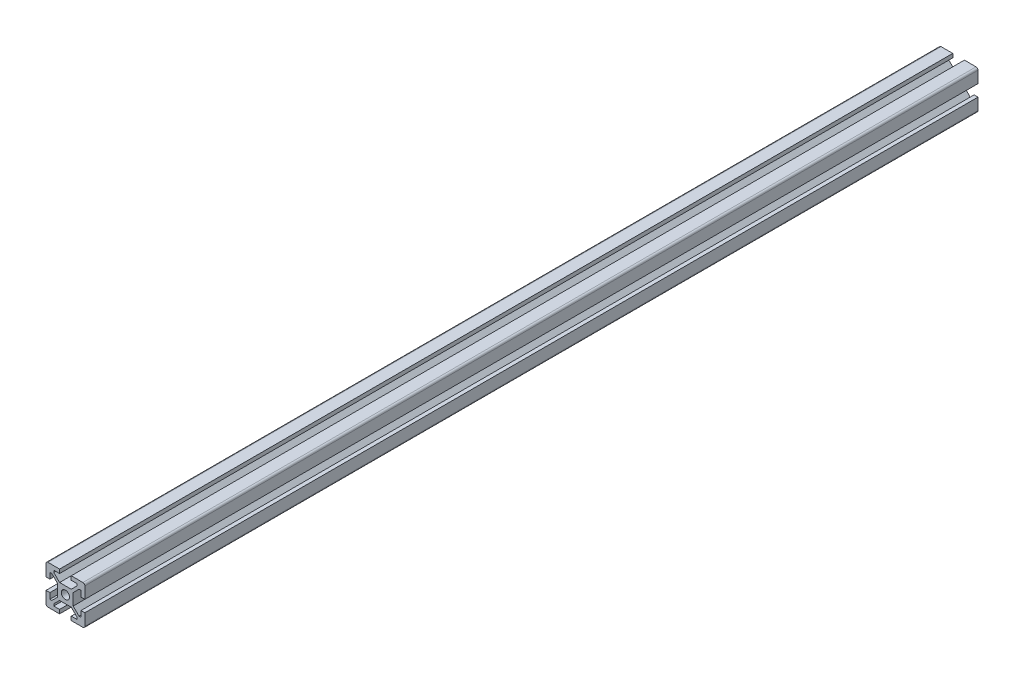
from build123d import *

# Parameters (mm, degrees)
SCHIZZO1_R                   = 2.1
ESTRUSIONE_ESTRUSIONE1_DEPTH = 460
RACCORDO1_R                  = 1


with BuildPart() as part:
    # Schizzo1 → Estrusione-Estrusione1 (new body)
    with BuildSketch(Plane.XY):
        Polygon((10, 3), (10, 10), (3, 10), (3, 8), (6, 8), (6, 7), (3, 4), (-3, 4), (-6, 7), (-6, 8), (-3, 8), (-3, 10), (-10, 10), (-10, 3), (-8, 3), (-8, 6), (-7, 6), (-4, 3), (-4, -3), (-7, -6), (-8, -6), (-8, -3), (-10, -3), (-10, -10), (-3, -10), (-3, -8), (-6, -8), (-6, -7), (-3, -4), (3, -4), (6, -7), (6, -8), (3, -8), (3, -10), (10, -10), (10, -3), (8, -3), (8, -6), (7, -6), (4, -3), (4, 3), (7, 6), (8, 6), (8, 3), align=None)
        Circle(SCHIZZO1_R, mode=Mode.SUBTRACT)
    extrude(amount=ESTRUSIONE_ESTRUSIONE1_DEPTH)

    # Raccordo1
    raccordo1_edges = [part.edges().sort_by_distance(p)[0] for p in [
        (-10, -10, 230),
        (10, -10, 230),
        (-10, 10, 230),
        (10, 10, 230),
    ]]
    fillet(raccordo1_edges, radius=RACCORDO1_R)


solid = part.part
